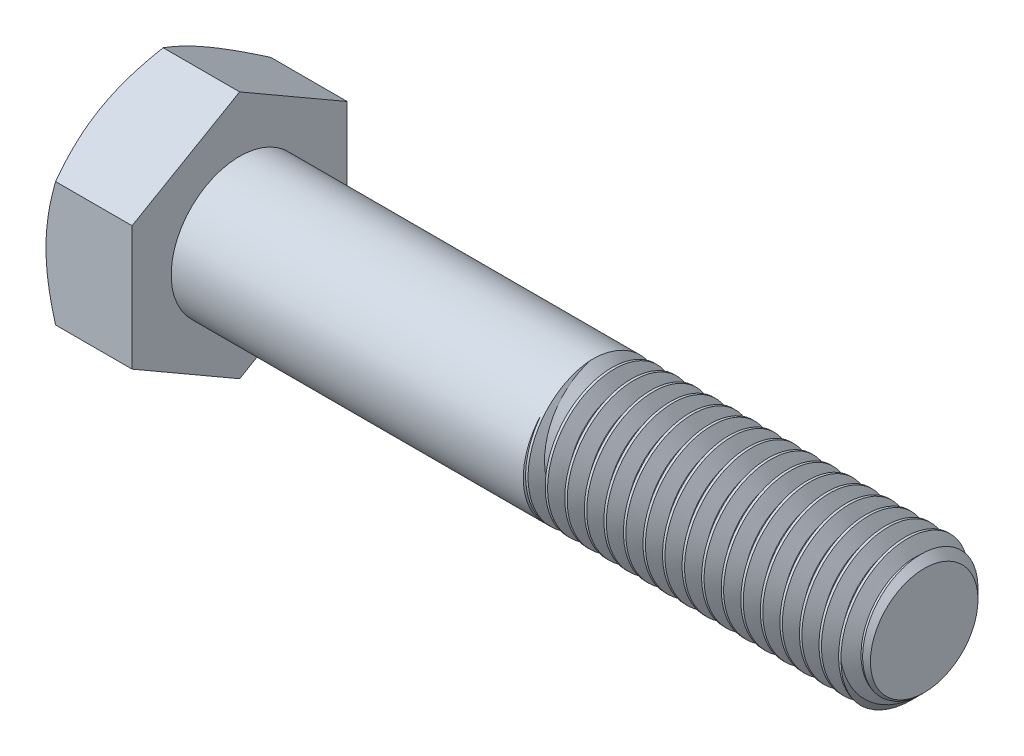
from build123d import *

# Parameters (mm, degrees)
SKETCH2_R           = 7
BOSS_EXTRUDE1_DEPTH = 70
CHAMFER1_SIZE       = 1.5
CUT_SWEEP1_PITCH    = 2
BOSS_EXTRUDE2_DEPTH = 8.8
SKETCH6_OUTSIDE_W   = 323.706
SKETCH6_OUTSIDE_H   = 327.11
SKETCH6_OUTSIDE_R   = 11
CUT_EXTRUDE1_DEPTH  = 81.571541836
CUT_EXTRUDE1_DRAFT  = -60
SKETCH7_W           = 0.460980277
SKETCH7_H           = 0.460980277
CUT_EXTRUDE2_DEPTH  = 0.25


with BuildPart() as part:
    # Sketch2 → Boss-Extrude1 (new body)
    with BuildSketch(Plane(origin=(39.4, 0, 0), x_dir=(0, 0, -1), z_dir=(1, 0, 0))):
        Circle(SKETCH2_R)
    extrude(amount=-BOSS_EXTRUDE1_DEPTH)

    # Chamfer1
    chamfer1_edges = [part.edges().sort_by_distance(p)[0] for p in [
        (39.4, 0, 7),
    ]]
    chamfer(chamfer1_edges, length=CHAMFER1_SIZE)

    # Cut-Sweep1: the profile of Sketch5 profile screwed along a right-hand helix of 36 turns, 10 arcs to a turn; built about Z, then put on its axis
    cut_sweep1_z = Axis((0, 0, 0), (0, 0, 1))
    cut_sweep1_corners = [(7.0003, 0, 0.000173205), (5.700961894, 0, -0.75), (5.700961894, 0, -1), (7.0003, 0, -1.750173205)]
    with BuildLine(mode=Mode.PRIVATE) as cut_sweep1_profile:
        Line(cut_sweep1_corners[0], cut_sweep1_corners[1])
        Line(cut_sweep1_corners[1], cut_sweep1_corners[2])
        Line(cut_sweep1_corners[2], cut_sweep1_corners[3])
        Line(cut_sweep1_corners[3], cut_sweep1_corners[0])
    cut_sweep1_cap = Face(cut_sweep1_profile.wire())
    cut_sweep1_turn_angles = [0, 18, 36, 54, 72, 90, 108, 126, 144, 162, 180, 198, 216, 234, 252, 270, 288, 306, 324, 342, 360]
    cut_sweep1_turn_weights = [1, 0.9510565162951535, 1, 0.9510565162951535, 1, 0.9510565162951535, 1, 0.9510565162951535, 1, 0.9510565162951535, 1, 0.9510565162951535, 1, 0.9510565162951535, 1, 0.9510565162951535, 1, 0.9510565162951535, 1, 0.9510565162951535, 1]
    cut_sweep1_turn_rails = [Edge.make_bspline([Vector(p[0], p[1], 0).rotate(cut_sweep1_z, cut_sweep1_turn_angles[k]) / cut_sweep1_turn_weights[k] + Vector(0, 0, p[2] + CUT_SWEEP1_PITCH * cut_sweep1_turn_angles[k] / 360) for k in range(21)], [0, 0, 0, 1, 1, 2, 2, 3, 3, 4, 4, 5, 5, 6, 6, 7, 7, 8, 8, 9, 9, 10, 10, 10], 2, cut_sweep1_turn_weights) for p in cut_sweep1_corners]
    cut_sweep1_turn_sides = [Face.make_surface_from_curves(cut_sweep1_turn_rails[p[0]], cut_sweep1_turn_rails[p[1]]) for p in [(0, 1), (1, 2), (2, 3), (3, 0)]]
    cut_sweep1 = Plane(origin=(39.4, 0, 0), x_dir=(0, 1, 0), z_dir=(-1, 0, 0)) * Solid(Shell([*[p.moved(Location((0, 0, CUT_SWEEP1_PITCH * i))) for i in range(36) for p in cut_sweep1_turn_sides], cut_sweep1_cap, cut_sweep1_cap.rotate(cut_sweep1_z, 12960).moved(Location((0, 0, CUT_SWEEP1_PITCH * 12960 / 360)))]))
    add(cut_sweep1, mode=Mode.SUBTRACT)

    # Sketch3 → Boss-Extrude2 (add)
    with BuildSketch(Plane.ZY.offset(30.6)):
        Polygon((-11, -6.350852961), (0, -12.701705922), (11, -6.350852961), (11, 6.350852961), (0, 12.701705922), (-11, 6.350852961), align=None)
    extrude(amount=BOSS_EXTRUDE2_DEPTH)


with BuildPart() as cut_extrude1_tool:
    # Sketch6 outside → Cut-Extrude1 (with draft: the straight prism first)
    with BuildSketch(Plane.ZY.offset(39.4)):
        Rectangle(SKETCH6_OUTSIDE_W, SKETCH6_OUTSIDE_H)
        Circle(SKETCH6_OUTSIDE_R, mode=Mode.SUBTRACT)
    extrude(amount=-CUT_EXTRUDE1_DEPTH)
    # Cut-Extrude1: the draft: its side faces are tilted about the plane it starts from
    cut_extrude1_sides = [cut_extrude1_tool.faces().sort_by_distance(p)[0] for p in [
        (1.385770918, -163.555, 0),
        (1.385770918, 0, 161.853),
        (1.385770918, 163.555, 0),
        (1.385770918, 0, -161.853),
        (1.385770918, 0, -11),
    ]]
    draft(cut_extrude1_sides, Plane.ZY.offset(39.4), CUT_EXTRUDE1_DRAFT)


with BuildPart() as part_1:
    add(part.part)

    # Cut-Extrude1: cut by cut_extrude1_tool
    add(cut_extrude1_tool.part, mode=Mode.SUBTRACT)

    # Sketch7 → Cut-Extrude2 (cut)
    # profile 1 of 4: a face of its own
    with BuildSketch(Plane.ZY.offset(39.4)):
        with BuildLine():
            Line((-2.996371799, 5.5), (-3.457352076, 5.5))
            Line((-3.457352076, 5.5), (-3.457352076, 8.301895745))
            add(Edge.make_bspline(
                [(-3.457352076, 8.301895745), (-3.483895361, 8.276298012), (-3.53906267, 8.22309593), (-3.632317179, 8.147801698), (-3.736401128, 8.071487802), (-3.849962921, 7.99810346), (-3.965719959, 7.929020016), (-4.077584232, 7.866890079), (-4.18368812, 7.814313078), (-4.253579324, 7.785563766), (-4.287116574, 7.771768426)],
                knots=[0, 0, 0, 0, 0.893362401, 1.856755847, 2.901947673, 4.020460078, 5.132200827, 6.168787962, 7.121294059, 8, 8, 8, 8], degree=3))
            Line((-4.287116574, 7.771768426), (-4.287116574, 8.196734619))
            add(Edge.make_bspline(
                [(-4.287116574, 8.196734619), (-4.229512881, 8.226400636), (-4.115979413, 8.284870599), (-3.955581174, 8.385856264), (-3.805832163, 8.495328881), (-3.66921132, 8.613264214), (-3.54673944, 8.733815295), (-3.443530608, 8.855456071), (-3.357172025, 8.973727716), (-3.313844288, 9.056209073), (-3.293127852, 9.095646159)],
                knots=[0, 0, 0, 0, 1.141258006, 2.249351951, 3.335817539, 4.406819942, 5.426913362, 6.360259544, 7.215985427, 8, 8, 8, 8], degree=3))
            Line((-3.293127852, 9.095646159), (-2.996371799, 9.095646159))
            Line((-2.996371799, 9.095646159), (-2.996371799, 5.5))
        make_face()
    # profile 2 of 4: a face of its own
    with BuildSketch(Plane.ZY.offset(39.4)):
        with BuildLine():
            add(Edge.make_bspline(
                [(-1.843921107, 7.273333502), (-1.843456669, 7.324718586), (-1.842547031, 7.425360327), (-1.836904843, 7.572617274), (-1.827054039, 7.712461099), (-1.8123495, 7.844770354), (-1.794936571, 7.969843687), (-1.772299654, 8.087502607), (-1.746829832, 8.198011099), (-1.716270615, 8.301253976), (-1.68269604, 8.398118939), (-1.644604614, 8.488450595), (-1.601746592, 8.572153172), (-1.55622818, 8.650094711), (-1.505653196, 8.721062901), (-1.453074243, 8.7870494), (-1.394670198, 8.845634225), (-1.332869626, 8.89832477), (-1.266762498, 8.944821106), (-1.196698586, 8.984941835), (-1.122947476, 9.020365546), (-1.044103555, 9.047032506), (-0.961803607, 9.068771732), (-0.87541413, 9.08476337), (-0.784839923, 9.094190981), (-0.722945185, 9.09515562), (-0.691470415, 9.095646159)],
                knots=[0, 0, 0, 0, 1.514747001, 2.966751498, 4.343369068, 5.64627492, 6.890416844, 8.064737671, 9.177176366, 10.232018008, 11.237056675, 12.19799043, 13.119080079, 14.007588942, 14.855863561, 15.685992447, 16.491747269, 17.290132607, 18.077525251, 18.870243746, 19.668095604, 20.485086593, 21.319398728, 22.175900658, 23.072407314, 24, 24, 24, 24], degree=3))
            add(Edge.make_bspline(
                [(-0.691470415, 9.095646159), (-0.645292834, 9.094288571), (-0.554575124, 9.091621534), (-0.422126799, 9.069869669), (-0.297302789, 9.03265975), (-0.180184192, 8.982461965), (-0.072773131, 8.918701117), (0.023149473, 8.841190091), (0.106548941, 8.750742739), (0.176515097, 8.646287288), (0.2376725, 8.530705319), (0.292003395, 8.403478055), (0.341116946, 8.264748071), (0.37596899, 8.140565367), (0.400828925, 8.033366452), (0.417284227, 7.944951818), (0.430945427, 7.849551931), (0.441411752, 7.747397588), (0.449999124, 7.638603365), (0.456630759, 7.523101524), (0.459996992, 7.400603387), (0.460646371, 7.316552098), (0.460980277, 7.273333502)],
                knots=[0, 0, 0, 0, 1.134486744, 2.228744715, 3.287356444, 4.328707449, 5.352829806, 6.347195599, 7.349461267, 8.364207941, 9.428085653, 10.559314403, 11.761222316, 13.04268526, 13.726896727, 14.465273606, 15.252205015, 16.094778733, 16.988606776, 17.934225168, 18.937792761, 20, 20, 20, 20], degree=3))
            add(Edge.make_bspline(
                [(0.460980277, 7.273333502), (0.460507139, 7.222189781), (0.459582772, 7.122270456), (0.454091769, 6.976194262), (0.443647385, 6.83740549), (0.430795379, 6.705586217), (0.411352987, 6.581088338), (0.390402756, 6.463382893), (0.364492495, 6.35300437), (0.334261304, 6.249904392), (0.300214118, 6.153537803), (0.26287611, 6.06317632), (0.221520681, 5.978881686), (0.174916937, 5.901476069), (0.12519721, 5.82993204), (0.071997357, 5.76398122), (0.014189479, 5.704572833), (-0.048168013, 5.652040332), (-0.113810986, 5.60471945), (-0.184045236, 5.564202608), (-0.258563359, 5.530635109), (-0.336867471, 5.501936564), (-0.41975208, 5.480907954), (-0.506563566, 5.464810881), (-0.597621787, 5.455331759), (-0.659755929, 5.454385144), (-0.691470415, 5.453901972)],
                knots=[0, 0, 0, 0, 1.508974709, 2.94807912, 4.311757619, 5.615040294, 6.854280449, 8.028314546, 9.141715822, 10.197470207, 11.196696834, 12.155719058, 13.080757287, 13.963948316, 14.818758719, 15.649605906, 16.461113142, 17.260189315, 18.052359509, 18.845763934, 19.647754795, 20.461145776, 21.303032214, 22.167241874, 23.064524267, 24, 24, 24, 24], degree=3))
            add(Edge.make_bspline(
                [(-0.691470415, 5.453901972), (-0.733051784, 5.455088083), (-0.814124007, 5.457400673), (-0.932524012, 5.473113294), (-1.043648732, 5.500768244), (-1.14843544, 5.537857433), (-1.245706306, 5.587466358), (-1.335925758, 5.647825302), (-1.420906692, 5.717529952), (-1.469826885, 5.77252532), (-1.494584491, 5.800357462)],
                knots=[0, 0, 0, 0, 1.10322584, 2.150986741, 3.161425019, 4.136713905, 5.093944212, 6.049774532, 7.013026876, 8, 8, 8, 8], degree=3))
            add(Edge.make_bspline(
                [(-1.494584491, 5.800357462), (-1.523081066, 5.841464189), (-1.581842222, 5.926228019), (-1.650617061, 6.070758213), (-1.711965435, 6.229865664), (-1.760112661, 6.406672042), (-1.797823941, 6.599770167), (-1.8250609, 6.809538939), (-1.840474338, 7.035887732), (-1.842746248, 7.192398179), (-1.843921107, 7.273333502)],
                knots=[0, 0, 0, 0, 0.779365345, 1.607084704, 2.489375761, 3.438383567, 4.461919411, 5.557722155, 6.737039282, 8, 8, 8, 8], degree=3))
        make_face()
        with BuildLine():
            add(Edge.make_bspline(
                [(-1.38294083, 7.274774066), (-1.382483114, 7.205616712), (-1.381606942, 7.07323424), (-1.372453081, 6.884103038), (-1.356695085, 6.713480878), (-1.335861986, 6.561603997), (-1.30835386, 6.42826695), (-1.273814154, 6.313809523), (-1.23487969, 6.216857966), (-1.186699029, 6.13861392), (-1.133946527, 6.074833608), (-1.079483173, 6.019980477), (-1.022027634, 5.973356572), (-0.9619548, 5.934481743), (-0.898332597, 5.905048277), (-0.831856725, 5.883714835), (-0.762512717, 5.871437767), (-0.715286297, 5.869673783), (-0.691470415, 5.868784221)],
                knots=[0, 0, 0, 0, 1.89448813, 3.626469325, 5.185477471, 6.587276848, 7.82441448, 8.910550357, 9.859733512, 10.6775885, 11.416198291, 12.123144072, 12.791880183, 13.439617036, 14.078171869, 14.70637855, 15.347637704, 16, 16, 16, 16], degree=3))
            add(Edge.make_bspline(
                [(-0.691470415, 5.868784221), (-0.667660497, 5.86969322), (-0.620445903, 5.871495747), (-0.55094167, 5.883502094), (-0.484724439, 5.905933767), (-0.421197097, 5.935263275), (-0.360687636, 5.973252029), (-0.303514278, 6.020052043), (-0.248764023, 6.074872604), (-0.196248483, 6.139394246), (-0.148434892, 6.218000041), (-0.108770065, 6.314872621), (-0.074768641, 6.429530497), (-0.047109573, 6.562799609), (-0.026190533, 6.714436361), (-0.010527812, 6.884585293), (-0.001312691, 7.073473144), (-0.00045098, 7.2056164), (0, 7.274774066)],
                knots=[0, 0, 0, 0, 0.652509534, 1.29391342, 1.924290653, 2.562989607, 3.207355802, 3.876242846, 4.583348185, 5.32723334, 6.150888545, 7.094226006, 8.186903555, 9.424320409, 10.81992305, 12.379283064, 14.105084285, 16, 16, 16, 16], degree=3))
            add(Edge.make_bspline(
                [(0, 7.274774066), (-0.00043654, 7.342492784), (-0.001272935, 7.472239286), (-0.010725727, 7.65772687), (-0.025539101, 7.825485207), (-0.045801444, 7.975668954), (-0.072730094, 8.108115067), (-0.105390873, 8.223105505), (-0.144311074, 8.320395031), (-0.190587055, 8.400960923), (-0.242101481, 8.46704681), (-0.295913182, 8.524249896), (-0.353367457, 8.572899257), (-0.415482222, 8.611926492), (-0.480255402, 8.643412214), (-0.549175319, 8.665081489), (-0.621564546, 8.678394414), (-0.671244333, 8.679965054), (-0.696512387, 8.68076391)],
                knots=[0, 0, 0, 0, 1.850066095, 3.544656626, 5.0727657, 6.45041401, 7.682899467, 8.762389858, 9.712573485, 10.538438529, 11.291566246, 11.996865408, 12.681389046, 13.341983376, 13.996294293, 14.643563182, 15.31009126, 16, 16, 16, 16], degree=3))
            add(Edge.make_bspline(
                [(-0.696512387, 8.68076391), (-0.720326773, 8.680138876), (-0.767285691, 8.67890639), (-0.836039697, 8.667142321), (-0.901197061, 8.647470176), (-0.963504275, 8.620822346), (-1.021405874, 8.58495963), (-1.07719809, 8.543087356), (-1.128267832, 8.492070664), (-1.15904201, 8.453931382), (-1.174779424, 8.434427574)],
                knots=[0, 0, 0, 0, 1.021318143, 2.013908504, 2.982026795, 3.937174072, 4.91255697, 5.897578595, 6.924855925, 8, 8, 8, 8], degree=3))
            add(Edge.make_bspline(
                [(-1.174779424, 8.434427574), (-1.191912667, 8.405782522), (-1.228094468, 8.345290202), (-1.268579799, 8.240152058), (-1.30434294, 8.119999172), (-1.333787863, 7.982982904), (-1.355089198, 7.829338293), (-1.371905779, 7.659243767), (-1.380641367, 7.472461855), (-1.382153195, 7.342488085), (-1.38294083, 7.274774066)],
                knots=[0, 0, 0, 0, 0.671104906, 1.417232262, 2.260109084, 3.195198885, 4.23592645, 5.382417421, 6.636286093, 8, 8, 8, 8], degree=3))
        make_face(mode=Mode.SUBTRACT)
    # profile 3 of 4: a face of its own
    with BuildSketch(Plane.ZY.offset(39.4)):
        with Locations((1.382940831, 5.730490139)):
            Rectangle(SKETCH7_W, SKETCH7_H)
    # profile 4 of 4: a face of its own
    with BuildSketch(Plane.ZY.offset(39.4)):
        with BuildLine():
            Line((2.350999412, 6.375862526), (2.811979688, 6.421960554))
            add(Edge.make_bspline(
                [(2.811979688, 6.421960554), (2.816147225, 6.398341739), (2.824203427, 6.352684566), (2.842383736, 6.287615271), (2.860823029, 6.226944454), (2.884625672, 6.172023717), (2.909414389, 6.121361261), (2.937486932, 6.075464762), (2.969343457, 6.035256037), (3.014329054, 5.988138577), (3.078157067, 5.938970709), (3.166631343, 5.899142819), (3.263961358, 5.872363717), (3.332552217, 5.870004661), (3.368037147, 5.868784221)],
                knots=[0, 0, 0, 0, 0.994516507, 1.922484754, 2.80151264, 3.623050913, 4.402748861, 5.140924173, 5.850441436, 6.526872911, 7.841975818, 9.161260782, 10.53140107, 12, 12, 12, 12], degree=3))
            add(Edge.make_bspline(
                [(3.368037147, 5.868784221), (3.399086806, 5.869902348), (3.460197348, 5.872102994), (3.549298541, 5.889162578), (3.634032392, 5.916491675), (3.712923919, 5.955703207), (3.785685997, 6.003422546), (3.849241219, 6.060122733), (3.904438244, 6.123361762), (3.949772148, 6.196225257), (3.988465859, 6.279447598), (4.025026269, 6.3740872), (4.059611812, 6.481774541), (4.090349408, 6.601136104), (4.117873421, 6.727814215), (4.137189507, 6.858938485), (4.149073942, 6.991959652), (4.150345307, 7.081473747), (4.150983336, 7.126396039)],
                knots=[0, 0, 0, 0, 0.897794352, 1.766998465, 2.614902619, 3.466100941, 4.308008728, 5.124841802, 5.922729683, 6.728261092, 7.598214292, 8.574707161, 9.662086263, 10.868425066, 12.139522319, 13.41071447, 14.70057738, 16, 16, 16, 16], degree=3))
            add(Edge.make_bspline(
                [(4.150983336, 7.126396039), (4.150765136, 7.138641351), (4.150243105, 7.167937541), (4.149345128, 7.197224752), (4.148822491, 7.214270404)],
                knots=[0, 0, 0, 0, 0.835966126, 2, 2, 2, 2], degree=3))
            add(Edge.make_bspline(
                [(4.148822491, 7.214270404), (4.126599363, 7.18052297), (4.082188916, 7.113082481), (4.000373904, 7.022569181), (3.906776094, 6.942282655), (3.802816233, 6.872846336), (3.691061336, 6.815861328), (3.57345559, 6.774453713), (3.451012799, 6.748885055), (3.367680197, 6.746070176), (3.325540528, 6.744646747)],
                knots=[0, 0, 0, 0, 0.978840568, 1.956103883, 2.947027447, 3.962820877, 4.980997961, 5.980964245, 6.979013046, 8, 8, 8, 8], degree=3))
            add(Edge.make_bspline(
                [(3.325540528, 6.744646747), (3.290423996, 6.745556578), (3.221296428, 6.747347597), (3.120036703, 6.76326561), (3.022644695, 6.787136986), (2.930043301, 6.823279405), (2.840791777, 6.867978278), (2.755827262, 6.922842717), (2.675018834, 6.987798044), (2.599410667, 7.062035456), (2.530411563, 7.144782767), (2.469562317, 7.234024097), (2.419033186, 7.330195804), (2.376991199, 7.432097528), (2.34455138, 7.540713847), (2.322009953, 7.655790262), (2.306849761, 7.776887494), (2.305559458, 7.859834973), (2.304901384, 7.902139411)],
                knots=[0, 0, 0, 0, 0.975490236, 1.920271282, 2.842894855, 3.757591483, 4.67685385, 5.613562631, 6.563069669, 7.554119451, 8.55387214, 9.553424333, 10.550567425, 11.568071726, 12.613215376, 13.695622473, 14.824733476, 16, 16, 16, 16], degree=3))
            add(Edge.make_bspline(
                [(2.304901384, 7.902139411), (2.305887007, 7.94587689), (2.307815057, 8.031434985), (2.322379152, 8.156531546), (2.346474128, 8.27504497), (2.381613327, 8.386749047), (2.425068767, 8.492361505), (2.479864392, 8.591120899), (2.543890245, 8.683449695), (2.617528876, 8.768457761), (2.698457066, 8.844733527), (2.784379373, 8.912810976), (2.876415435, 8.968770315), (2.972800538, 9.015426443), (3.0742641, 9.051483002), (3.180632706, 9.077544318), (3.292200695, 9.092836284), (3.368230014, 9.094698306), (3.406932358, 9.095646159)],
                knots=[0, 0, 0, 0, 1.151671969, 2.252870106, 3.311924673, 4.331900944, 5.332425074, 6.314476151, 7.300265758, 8.286521684, 9.270545387, 10.225535917, 11.167946231, 12.101233205, 13.04124339, 13.998220545, 14.981004193, 16, 16, 16, 16], degree=3))
            add(Edge.make_bspline(
                [(3.406932358, 9.095646159), (3.435041411, 9.095077663), (3.49091281, 9.093947682), (3.574061051, 9.085320652), (3.655240352, 9.069769019), (3.734979995, 9.050138487), (3.811934993, 9.022889829), (3.887588773, 8.991379545), (3.96102884, 8.952840085), (4.032683122, 8.909015889), (4.102101573, 8.860677304), (4.165970549, 8.805141502), (4.226842859, 8.746204992), (4.283479828, 8.682018073), (4.334090037, 8.611590131), (4.382109394, 8.53741114), (4.425223127, 8.45786249), (4.464539859, 8.372836444), (4.499533275, 8.280582768), (4.52872655, 8.179062754), (4.553751701, 8.067924778), (4.574587607, 7.947021526), (4.590037771, 7.816439194), (4.601408189, 7.67637185), (4.608851914, 7.526712956), (4.609479587, 7.423641566), (4.609802768, 7.370571529)],
                knots=[0, 0, 0, 0, 0.850689348, 1.69088598, 2.526071361, 3.350886897, 4.173587108, 4.994166539, 5.82944675, 6.680632524, 7.535501428, 8.385942454, 9.238956306, 10.098905971, 10.972410977, 11.861345628, 12.77184846, 13.708225841, 14.694799433, 15.754852217, 16.902446579, 18.141290626, 19.466225842, 20.880733292, 22.39393263, 24, 24, 24, 24], degree=3))
            add(Edge.make_bspline(
                [(4.609802768, 7.370571529), (4.609477424, 7.315100931), (4.608843343, 7.206990966), (4.60134118, 7.049177854), (4.589976478, 6.899997353), (4.574515396, 6.759351494), (4.553534239, 6.627454934), (4.528596465, 6.504330732), (4.499186612, 6.389751579), (4.464625751, 6.283707414), (4.425336729, 6.184979577), (4.382287566, 6.092352377), (4.33407489, 6.005962792), (4.281240416, 5.925645148), (4.224462573, 5.85125906), (4.162854867, 5.783003796), (4.096397291, 5.721085683), (4.025936966, 5.664807891), (3.951579636, 5.615213024), (3.874337562, 5.571451723), (3.79333902, 5.535603557), (3.7094167, 5.50619501), (3.622719728, 5.481913482), (3.532541947, 5.465552545), (3.439299975, 5.456286269), (3.376220559, 5.454703646), (3.344267852, 5.453901972)],
                knots=[0, 0, 0, 0, 1.538356107, 2.998194159, 4.380716326, 5.687456969, 6.921258146, 8.08355215, 9.170518603, 10.200253214, 11.174652363, 12.115998813, 13.031191965, 13.915860606, 14.780247615, 15.624154577, 16.462764255, 17.29681422, 18.1223677, 18.939254916, 19.756006416, 20.575278551, 21.404021733, 22.250368457, 23.113728878, 24, 24, 24, 24], degree=3))
            add(Edge.make_bspline(
                [(3.344267852, 5.453901972), (3.310376412, 5.454487958), (3.244067671, 5.455634442), (3.147263732, 5.467689799), (3.05504513, 5.486017871), (2.967680252, 5.513074445), (2.884514817, 5.546380362), (2.806968298, 5.588943429), (2.733662595, 5.638048474), (2.665502073, 5.694685743), (2.6032848, 5.758647248), (2.546990058, 5.828356634), (2.497636155, 5.904716757), (2.455481377, 5.987277419), (2.418142023, 6.075344034), (2.389193868, 6.170097522), (2.365676278, 6.270663972), (2.355970702, 6.340230082), (2.350999412, 6.375862526)],
                knots=[0, 0, 0, 0, 1.08199657, 2.11693069, 3.111083497, 4.081436044, 5.034173265, 5.967546613, 6.901297947, 7.84883568, 8.792454994, 9.747011506, 10.706361727, 11.690764787, 12.70483191, 13.757514363, 14.851376857, 16, 16, 16, 16], degree=3))
        make_face()
        with BuildLine():
            add(Edge.make_bspline(
                [(4.148822491, 7.912223355), (4.14830403, 7.941057495), (4.147294879, 7.997181301), (4.138453486, 8.079065236), (4.124227743, 8.15617558), (4.104260863, 8.228955728), (4.077145247, 8.296634183), (4.045733654, 8.360791057), (4.007320437, 8.419648111), (3.963977867, 8.473997899), (3.916235151, 8.522612531), (3.864243773, 8.565000142), (3.808978533, 8.601335933), (3.749113608, 8.629905638), (3.686616954, 8.653446971), (3.619987313, 8.668832672), (3.550141502, 8.679610662), (3.502053468, 8.680374312), (3.477519963, 8.68076391)],
                knots=[0, 0, 0, 0, 1.20361398, 2.342757417, 3.433960756, 4.474970456, 5.487648377, 6.473933575, 7.452701285, 8.415527761, 9.372491588, 10.291530068, 11.211879743, 12.12647906, 13.055739058, 13.994253148, 14.97671008, 16, 16, 16, 16], degree=3))
            add(Edge.make_bspline(
                [(3.477519963, 8.68076391), (3.452284997, 8.679999222), (3.402572048, 8.678492784), (3.329707835, 8.66879126), (3.260605106, 8.650215828), (3.19479734, 8.62557594), (3.131553645, 8.595096832), (3.073173182, 8.555159884), (3.017210771, 8.509901425), (2.965910979, 8.457395584), (2.91905031, 8.399828602), (2.877760895, 8.337740811), (2.842989977, 8.271101789), (2.815194966, 8.200189374), (2.792480017, 8.125621645), (2.776876462, 8.046731848), (2.767275373, 7.96360397), (2.766353155, 7.906728235), (2.765881661, 7.877649834)],
                knots=[0, 0, 0, 0, 1.007165334, 1.984118292, 2.925321257, 3.856078893, 4.785899085, 5.718627206, 6.671847665, 7.654235469, 8.641842333, 9.630378272, 10.624608936, 11.635186472, 12.665777387, 13.731187195, 14.840042241, 16, 16, 16, 16], degree=3))
            add(Edge.make_bspline(
                [(2.765881661, 7.877649834), (2.766317122, 7.851681826), (2.767170892, 7.800768657), (2.77733835, 7.726465525), (2.790900231, 7.655549973), (2.812520432, 7.588745869), (2.838566494, 7.525083347), (2.872418363, 7.466024512), (2.910532345, 7.409803389), (2.955190254, 7.358303394), (3.004559668, 7.311583869), (3.05848109, 7.270862775), (3.116273435, 7.236004811), (3.178473619, 7.20794909), (3.244708634, 7.186342059), (3.314830635, 7.170434926), (3.389144426, 7.160960243), (3.440037631, 7.160012426), (3.465995456, 7.159528996)],
                knots=[0, 0, 0, 0, 1.102204012, 2.160993585, 3.181057555, 4.164839289, 5.138418409, 6.097303793, 7.050641095, 8.019669129, 8.986440483, 9.932879371, 10.884360123, 11.847412593, 12.824617322, 13.839006415, 14.897795988, 16, 16, 16, 16], degree=3))
            add(Edge.make_bspline(
                [(3.465995456, 7.159528996), (3.490274421, 7.16001715), (3.538060856, 7.160977945), (3.608062962, 7.170493019), (3.674578123, 7.186429653), (3.737904981, 7.208096178), (3.797940897, 7.236142197), (3.854282164, 7.271277171), (3.908017899, 7.311532931), (3.957572904, 7.358569822), (4.002864364, 7.410648858), (4.042033055, 7.468284535), (4.075481017, 7.530430172), (4.101807966, 7.597822403), (4.122894604, 7.669631508), (4.137740998, 7.746312123), (4.147463641, 7.827700556), (4.148362691, 7.883622977), (4.148822491, 7.912223355)],
                knots=[0, 0, 0, 0, 1.017004716, 2.00169281, 2.953445817, 3.879374072, 4.80207141, 5.723561102, 6.657273834, 7.611045633, 8.581233951, 9.544037932, 10.525327521, 11.53237926, 12.57032081, 13.657564536, 14.802009319, 16, 16, 16, 16], degree=3))
        make_face(mode=Mode.SUBTRACT)
    extrude(amount=-CUT_EXTRUDE2_DEPTH, mode=Mode.SUBTRACT)

    # Sketch9 → Revolve1 (revolve)
    with BuildSketch(Plane.XY, mode=Mode.PRIVATE) as revolve1_sk:
        Polygon((-30.6, 7), (-30.6, 0), (12.4, 0), (5.4, 7), align=None)
    revolve(revolve1_sk.sketch.rotate(Axis((-30.6, 0, 0), (1, 0, 0)), 270), axis=Axis((-30.6, 0, 0), (1, 0, 0)))


solid = part_1.part
